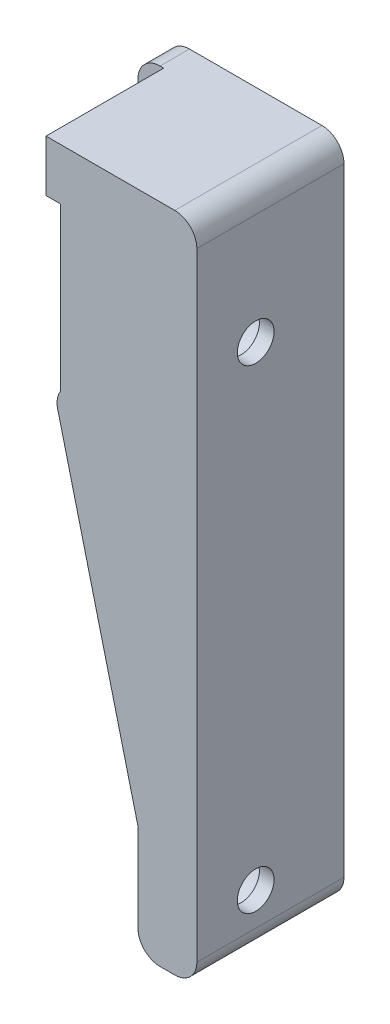
from build123d import *

# Parameters (mm, degrees)
SKETCH1_W            = 24
SKETCH1_H            = 90
BOSS_EXTRUDE1_DEPTH  = 20
CUT_EXTRUDE1_DEPTH   = 16
CUT_EXTRUDE8_DEPTH   = 10
SKETCH11_R           = 2.5
CUT_EXTRUDE9_DEPTH   = 18.5
SKETCH12_R           = 4.5
CUT_EXTRUDE10_DEPTH  = 16.5
FILLET1_R            = 20
FILLET2_R            = 3
FILLET1_OF_MIRROR1_R = 20
FILLET2_OF_MIRROR1_R = 3
SKETCH13_W           = 28.58864277
SKETCH13_H           = 106.823904202
CUT_EXTRUDE11_DEPTH  = 24


with BuildPart() as part:
    # Sketch1 → Boss-Extrude1 (new body)
    with BuildSketch(Plane.XY):
        with Locations((12, 45)):
            Rectangle(SKETCH1_W, SKETCH1_H)
    boss_extrude1 = extrude(amount=-BOSS_EXTRUDE1_DEPTH)

    # Sketch4 → Cut-Extrude1 (cut)
    with BuildSketch(Plane.XY):
        Polygon((20.5, 83), (18.5, 83), (18.5, 61), (19.5, 61), (8, 15), (8, 0), (24, 0), (24, 90), (20.5, 90), align=None)
    cut_extrude1 = extrude(amount=-CUT_EXTRUDE1_DEPTH, mode=Mode.SUBTRACT)

    # Sketch9 → Cut-Extrude8 (cut)
    with BuildSketch(Plane(origin=(0, 0, -20), x_dir=(-1, 0, 0), z_dir=(0, 0, -1))):
        Polygon((-24, 0), (-24, 45), (-8, 15), (-8, 0), align=None)
    cut_extrude8 = extrude(amount=-CUT_EXTRUDE8_DEPTH, mode=Mode.SUBTRACT)

    # Sketch11 → Cut-Extrude9 (cut)
    with BuildSketch(Plane(origin=(18.5, 0, 0), x_dir=(0, 0, -1), z_dir=(1, 0, 0))):
        with Locations(Location((8, 72, 0), (0, 0, 90))):
            Circle(SKETCH11_R)
        with Locations(Location((8, 7.5, 0), (0, 0, 90))):
            Circle(SKETCH11_R)
    cut_extrude9 = extrude(amount=-CUT_EXTRUDE9_DEPTH, mode=Mode.SUBTRACT)

    # Sketch12 → Cut-Extrude10 (cut)
    with BuildSketch(Plane(origin=(18.5, 0, 0), x_dir=(0, 0, -1), z_dir=(1, 0, 0))):
        with Locations(Location((8, 72, 0), (0, 0, 90))):
            Circle(SKETCH12_R)
        with Locations(Location((8, 7.5, 0), (0, 0, 90))):
            Circle(SKETCH12_R)
    cut_extrude10 = extrude(amount=-CUT_EXTRUDE10_DEPTH, mode=Mode.SUBTRACT)

    # Fillet1
    fillet1_edges = [part.edges().sort_by_distance(p)[0] for p in [
        (24, 45, -18),
    ]]
    fillet(fillet1_edges, radius=FILLET1_R)

    # Fillet2
    # the kernel refuses this fillet: 3 mm, written as the material it takes off along each edge
    with BuildSketch(Plane(origin=(0, 90, 7.5), x_dir=(1, 0, 0), z_dir=(0, 0, -1)), Plane(origin=(0, 0, 7.5), x_dir=(0, 1, 0), z_dir=(0, 0, -1)), Plane(origin=(8, 0, -27.5), x_dir=(0, 1, 0), z_dir=(0, 0, 1))) as fillet2_piece_1:
        with BuildLine():
            CenterArc((FILLET2_R, FILLET2_R), FILLET2_R, 180, 90)
            Line((0, FILLET2_R), (-FILLET2_R * 0.02, FILLET2_R))
            Line((-FILLET2_R * 0.02, FILLET2_R), (-FILLET2_R * 0.02, -FILLET2_R * 0.02))
            Line((-FILLET2_R * 0.02, -FILLET2_R * 0.02), (FILLET2_R, -FILLET2_R * 0.02))
            Line((FILLET2_R, -FILLET2_R * 0.02), (FILLET2_R, 0))
        make_face()
    extrude(amount=35, mode=Mode.SUBTRACT)
    with BuildSketch(Plane(origin=(24, 90, -8.5), x_dir=(0, -1, 0), z_dir=(0, 0, -1))) as fillet2_piece_2:
        with BuildLine():
            CenterArc((FILLET2_R, FILLET2_R), FILLET2_R, 180, 90)
            Line((0, FILLET2_R), (-FILLET2_R * 0.02, FILLET2_R))
            Line((-FILLET2_R * 0.02, FILLET2_R), (-FILLET2_R * 0.02, -FILLET2_R * 0.02))
            Line((-FILLET2_R * 0.02, -FILLET2_R * 0.02), (FILLET2_R, -FILLET2_R * 0.02))
            Line((FILLET2_R, -FILLET2_R * 0.02), (FILLET2_R, 0))
        make_face()
    extrude(amount=19, mode=Mode.SUBTRACT)
    with BuildSketch(Plane(origin=(19.5, 61, 6.128837665), x_dir=(-0.24253562503633366, -0.9701425001453317, 0), z_dir=(0, 0, -1))) as fillet2_piece_3:
        with BuildLine():
            CenterArc((2.451535066, 3), FILLET2_R, 222.580014358, 47.419985642)
            Line((0.242535625, 0.9701425), (0.198355636, 0.92954535))
            ThreePointArc((0.198355636, 0.92954535), (0.063059263, 0.499623388), (-0.05820855, 0.014552138))
            Line((-0.05820855, 0.014552138), (0, -0.06))
            Line((0, -0.06), (2.451535066, -0.06))
            Line((2.451535066, -0.06), (2.451535066, 0))
        make_face()
    extrude(amount=22.128837665, mode=Mode.SUBTRACT)


with BuildPart() as mirror1_1:
    # Mirror1: Boss-Extrude1 across plane
    add(boss_extrude1.mirror(Plane(origin=(24, 0, -20), x_dir=(0, 0, 1), z_dir=(1, 0, 0))))

    # Mirror1 2: Cut-Extrude1, Cut-Extrude8, Cut-Extrude9, Cut-Extrude10 across plane
    add(cut_extrude1.mirror(Plane(origin=(24, 0, -20), x_dir=(0, 0, 1), z_dir=(1, 0, 0))), mode=Mode.SUBTRACT)
    add(cut_extrude8.mirror(Plane(origin=(24, 0, -20), x_dir=(0, 0, 1), z_dir=(1, 0, 0))), mode=Mode.SUBTRACT)
    add(cut_extrude9.mirror(Plane(origin=(24, 0, -20), x_dir=(0, 0, 1), z_dir=(1, 0, 0))), mode=Mode.SUBTRACT)
    add(cut_extrude10.mirror(Plane(origin=(24, 0, -20), x_dir=(0, 0, 1), z_dir=(1, 0, 0))), mode=Mode.SUBTRACT)

    # Fillet1 of Mirror1
    fillet1_of_mirror1_edges = [mirror1_1.edges().sort_by_distance(p)[0] for p in [
        (24, 45, -18),
    ]]
    fillet(fillet1_of_mirror1_edges, radius=FILLET1_OF_MIRROR1_R)

    # Fillet2 of Mirror1
    # the kernel refuses this fillet: 3 mm, written as the material it takes off along each edge
    with BuildSketch(Plane(origin=(48, 90, 7.5), x_dir=(-1, 0, 0), z_dir=(0, 0, -1)), Plane(origin=(48, 0, 7.5), x_dir=(0, 1, 0), z_dir=(0, 0, -1))) as fillet2_of_mirror1_piece_1:
        with BuildLine():
            CenterArc((FILLET2_OF_MIRROR1_R, -FILLET2_OF_MIRROR1_R), FILLET2_OF_MIRROR1_R, 90, 90)
            Line((0, -FILLET2_OF_MIRROR1_R), (-FILLET2_OF_MIRROR1_R * 0.02, -FILLET2_OF_MIRROR1_R))
            Line((-FILLET2_OF_MIRROR1_R * 0.02, -FILLET2_OF_MIRROR1_R), (-FILLET2_OF_MIRROR1_R * 0.02, FILLET2_OF_MIRROR1_R * 0.02))
            Line((-FILLET2_OF_MIRROR1_R * 0.02, FILLET2_OF_MIRROR1_R * 0.02), (FILLET2_OF_MIRROR1_R, FILLET2_OF_MIRROR1_R * 0.02))
            Line((FILLET2_OF_MIRROR1_R, FILLET2_OF_MIRROR1_R * 0.02), (FILLET2_OF_MIRROR1_R, 0))
        make_face()
    extrude(amount=35, mode=Mode.SUBTRACT)
    with BuildSketch(Plane(origin=(24, 90, -8.5), x_dir=(0, -1, 0), z_dir=(0, 0, -1))) as fillet2_of_mirror1_piece_2:
        with BuildLine():
            CenterArc((FILLET2_OF_MIRROR1_R, -FILLET2_OF_MIRROR1_R), FILLET2_OF_MIRROR1_R, 90, 90)
            Line((0, -FILLET2_OF_MIRROR1_R), (-FILLET2_OF_MIRROR1_R * 0.02, -FILLET2_OF_MIRROR1_R))
            Line((-FILLET2_OF_MIRROR1_R * 0.02, -FILLET2_OF_MIRROR1_R), (-FILLET2_OF_MIRROR1_R * 0.02, FILLET2_OF_MIRROR1_R * 0.02))
            Line((-FILLET2_OF_MIRROR1_R * 0.02, FILLET2_OF_MIRROR1_R * 0.02), (FILLET2_OF_MIRROR1_R, FILLET2_OF_MIRROR1_R * 0.02))
            Line((FILLET2_OF_MIRROR1_R, FILLET2_OF_MIRROR1_R * 0.02), (FILLET2_OF_MIRROR1_R, 0))
        make_face()
    extrude(amount=19, mode=Mode.SUBTRACT)
    with BuildSketch(Plane(origin=(40, 0, 7.5), x_dir=(0, 1, 0), z_dir=(0, 0, -1))) as fillet2_of_mirror1_piece_3:
        with BuildLine():
            CenterArc((FILLET2_OF_MIRROR1_R, FILLET2_OF_MIRROR1_R), FILLET2_OF_MIRROR1_R, 180, 90)
            Line((0, FILLET2_OF_MIRROR1_R), (-FILLET2_OF_MIRROR1_R * 0.02, FILLET2_OF_MIRROR1_R))
            Line((-FILLET2_OF_MIRROR1_R * 0.02, FILLET2_OF_MIRROR1_R), (-FILLET2_OF_MIRROR1_R * 0.02, -FILLET2_OF_MIRROR1_R * 0.02))
            Line((-FILLET2_OF_MIRROR1_R * 0.02, -FILLET2_OF_MIRROR1_R * 0.02), (FILLET2_OF_MIRROR1_R, -FILLET2_OF_MIRROR1_R * 0.02))
            Line((FILLET2_OF_MIRROR1_R, -FILLET2_OF_MIRROR1_R * 0.02), (FILLET2_OF_MIRROR1_R, 0))
        make_face()
    extrude(amount=35, mode=Mode.SUBTRACT)
    with BuildSketch(Plane(origin=(28.5, 61, 6.128837665), x_dir=(0.24253562503633366, -0.9701425001453317, 0), z_dir=(0, 0, -1))) as fillet2_of_mirror1_piece_4:
        with BuildLine():
            CenterArc((2.451535066, -3), FILLET2_OF_MIRROR1_R, 90, 47.419985642)
            Line((0.242535625, -0.9701425), (0.198355636, -0.92954535))
            ThreePointArc((0.198355636, -0.92954535), (0.063059263, -0.499623388), (-0.05820855, -0.014552138))
            Line((-0.05820855, -0.014552138), (0, 0.06))
            Line((0, 0.06), (2.451535066, 0.06))
            Line((2.451535066, 0.06), (2.451535066, 0))
        make_face()
    extrude(amount=22.128837665, mode=Mode.SUBTRACT)


with BuildPart() as part_1:
    add(part.part)

    # Mirror1 united with what the copies touc: union Mirror1_1
    add(mirror1_1.part)

    # Sketch13 → Cut-Extrude11 (cut)
    with BuildSketch(Plane.ZY):
        with Locations((-8.954074045, 49.790814809)):
            Rectangle(SKETCH13_W, SKETCH13_H)
    extrude(amount=-CUT_EXTRUDE11_DEPTH, mode=Mode.SUBTRACT)


solid = part_1.part
